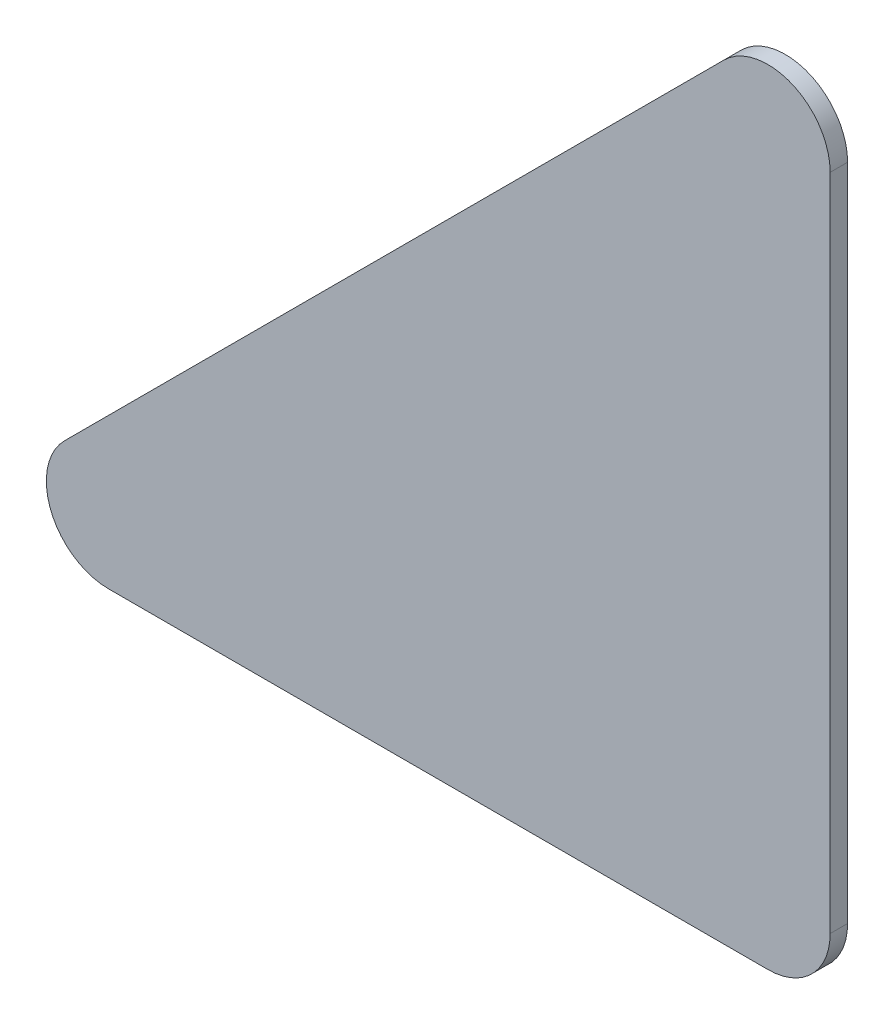
from build123d import *

# Parameters (mm, degrees)
BASE_FLANGE1_DEPTH  = 0.7
BREAK_CORNER1_START = -0.7
BREAK_CORNER1_DEPTH = 0.7


# Read off the part's stored shape, not the designer's step: Break-Corner1
# Sheet-metal steps are written as plain solids
with BuildPart() as part:
    # Sketch1 → Base-Flange1 (new body)
    with BuildSketch(Plane.XY):
        Polygon((0, 0), (0, 35), (-35, 0), align=None)
    extrude(amount=-BASE_FLANGE1_DEPTH)

    # Break-Corner1 outline → Break-Corner1 (cut)
    with BuildSketch(Plane.XY.offset(BREAK_CORNER1_START)):
        with BuildLine():
            ThreePointArc((-28.964466094, 0), (-31.274164925, 1.543291419), (-30.732233047, 4.267766953))
            Line((-30.732233047, 4.267766953), (-35, 0))
            Line((-35, 0), (-28.964466094, 0))
        make_face()
        with BuildLine():
            Line((0, 35), (-4.267766953, 30.732233047))
            ThreePointArc((-4.267766953, 30.732233047), (-1.543291419, 31.274164925), (0, 28.964466094))
            Line((0, 28.964466094), (0, 35))
        make_face()
        with BuildLine():
            ThreePointArc((0, 2.5), (-0.732233047, 0.732233047), (-2.5, 0))
            Line((-2.5, 0), (0, 0))
            Line((0, 0), (0, 2.5))
        make_face()
    extrude(amount=BREAK_CORNER1_DEPTH, mode=Mode.SUBTRACT)


solid = part.part
